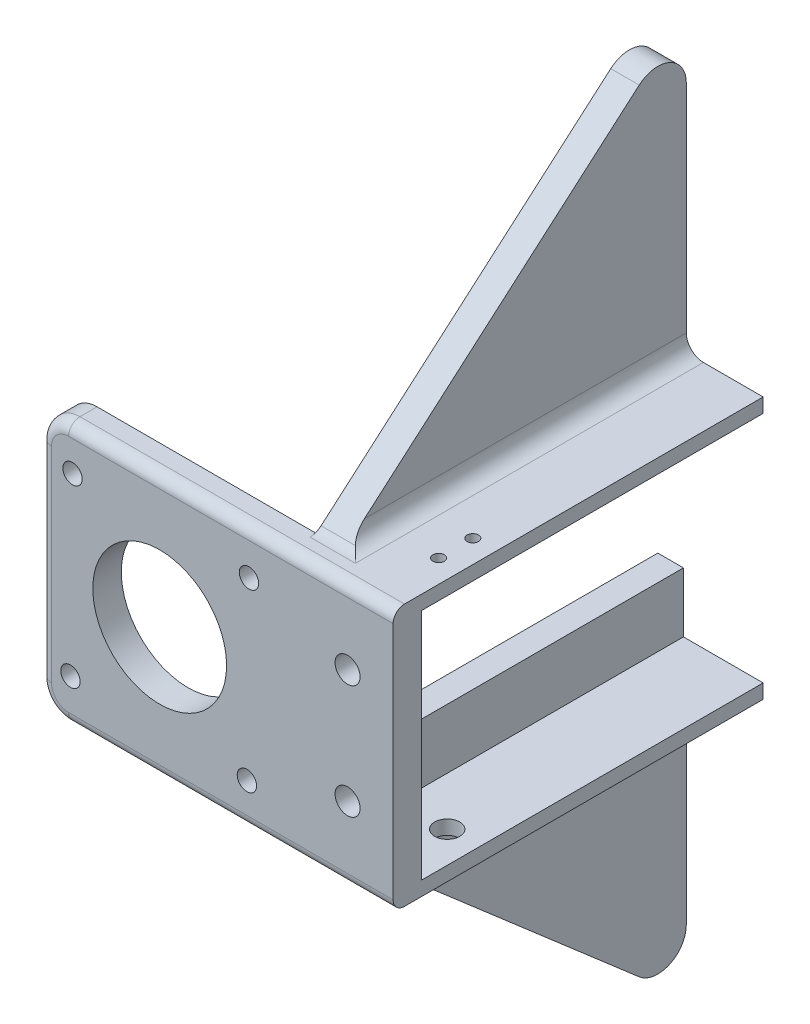
from build123d import *

# Parameters (mm, degrees)
SKETCH_1_W          = 14
SKETCH_1_H          = 2.5
SKETCH_1_R          = 1.7
SKETCH_1_R_2        = 11.75
SKETCH_1_R_3        = 2.2
SKETCH_1_W_2        = 4.5
SKETCH_1_H_2        = 20
EXTRUDE_1_DEPTH     = 5
EXTRUDE_2_DEPTH     = 60
CUT_EXTRUDE_1_REACH = 78.223
CUT_EXTRUDE_2_REACH = 78.223
SKETCH_2_3_R        = 1
EXTRUDE_3_DEPTH     = 5
FILLET_1_R          = 5
FILLET_START        = 22.5
FILLET_2_DEPTH      = 5
FILLET_START_2      = -60
FILLET_2_2_DEPTH    = 61.119099979
FILLET_START_3      = 27.5
FILLET_2_3_DEPTH    = 3
FILLET_3_R          = 2


with BuildPart() as part:
    # 草图1 → 凸台-拉伸1 (new body)
    # profile 1 of 9: a face of its own
    with BuildSketch(Plane.XY):
        with Locations((34, 21.75)):
            Rectangle(SKETCH_1_W, SKETCH_1_H)
    # profile 2 of 9: a face of its own
    with BuildSketch(Plane.XY):
        Polygon((27, 23), (22.5, 23), (22.5, 21.5), (22.5, 10), (27, 10), (27, 20.5), align=None)
    # profile 3 of 9: a face of its own
    with BuildSketch(Plane.XY):
        Polygon((-21, 23), (-21, 21.5), (21, 21.5), (22.5, 21.5), (22.5, 23), align=None)
    # profile 4 of 9: a face of its own
    with BuildSketch(Plane.XY):
        Polygon((21, 21.5), (-21, 21.5), (-21, -21.5), (21, -21.5), (22.5, -21.5), (22.5, -10), (22.5, 10), (22.5, 21.5), align=None)
        with Locations((-15.68126777, -15.316587124)):
            Circle(SKETCH_1_R, mode=Mode.SUBTRACT)
        with Locations((15.316587124, -15.68126777)):
            Circle(SKETCH_1_R, mode=Mode.SUBTRACT)
        Circle(SKETCH_1_R_2, mode=Mode.SUBTRACT)
        with Locations((-15.316587124, 15.68126777)):
            Circle(SKETCH_1_R, mode=Mode.SUBTRACT)
        with Locations((15.68126777, 15.316587124)):
            Circle(SKETCH_1_R, mode=Mode.SUBTRACT)
    # profile 5 of 9: a face of its own
    with BuildSketch(Plane.XY):
        Polygon((41, 20.5), (27, 20.5), (27, 10), (27, -10), (27, -20.5), (41, -20.5), align=None)
        with Locations((33, -10)):
            Circle(SKETCH_1_R_3, mode=Mode.SUBTRACT)
        with Locations((33, 10)):
            Circle(SKETCH_1_R_3, mode=Mode.SUBTRACT)
    # profile 6 of 9: a face of its own
    with BuildSketch(Plane.XY):
        with Locations((24.75, 0)):
            Rectangle(SKETCH_1_W_2, SKETCH_1_H_2)
    # profile 7 of 9: a face of its own
    with BuildSketch(Plane.XY):
        Polygon((22.5, -10), (22.5, -21.5), (22.5, -23), (27, -23), (27, -20.5), (27, -10), align=None)
    # profile 8 of 9: a face of its own
    with BuildSketch(Plane.XY):
        with Locations((34, -21.75)):
            Rectangle(SKETCH_1_W, SKETCH_1_H)
    # profile 9 of 9: a face of its own
    with BuildSketch(Plane.XY):
        Polygon((21, -21.5), (-21, -21.5), (-21, -23), (22.5, -23), (22.5, -21.5), align=None)
    extrude(amount=EXTRUDE_1_DEPTH)

    # 草图1<4> → 凸台-拉伸2 (add)
    with BuildSketch(Plane.XY):
        Polygon((22.5, 23), (22.5, 10), (27, 10), (27, 20.5), (41, 20.5), (41, 23), align=None)
        Polygon((22.5, -10), (22.5, -23), (41, -23), (41, -20.5), (27, -20.5), (27, -10), align=None)
    extrude(amount=-EXTRUDE_2_DEPTH)

    # 草图2 → 切除-拉伸1 (cut, up to next)
    with BuildSketch(Plane(origin=(0, 0, 0), x_dir=(1, 0, 0), z_dir=(0, 1, 0)), mode=Mode.PRIVATE) as cut_extrude_1_sk1:
        with BuildLine():
            ThreePointArc((37.7, 10), (35.5, 12.2), (33.3, 10))
            Line((33.3, 10), (37.7, 10))
        make_face()
    cut_extrude_1_tool1 = extrude(cut_extrude_1_sk1.sketch, amount=-CUT_EXTRUDE_1_REACH, mode=Mode.PRIVATE) & part.part
    # 草图2 → 切除-拉伸1 (cut, up to next)
    with BuildSketch(Plane(origin=(0, 0, 0), x_dir=(1, 0, 0), z_dir=(0, 1, 0)), mode=Mode.PRIVATE) as cut_extrude_1_sk2:
        with BuildLine():
            Line((37.7, 10), (33.3, 10))
            ThreePointArc((33.3, 10), (35.5, 7.8), (37.7, 10))
        make_face()
    cut_extrude_1_tool2 = extrude(cut_extrude_1_sk2.sketch, amount=-CUT_EXTRUDE_1_REACH, mode=Mode.PRIVATE) & part.part
    # 草图2 → 切除-拉伸1 (cut, up to next)
    with BuildSketch(Plane(origin=(0, 0, 0), x_dir=(1, 0, 0), z_dir=(0, 1, 0)), mode=Mode.PRIVATE) as cut_extrude_1_sk3:
        with BuildLine():
            ThreePointArc((37.7, 10), (35.5, 12.2), (33.3, 10))
            Line((33.3, 10), (37.7, 10))
        make_face()
    cut_extrude_1_tool3 = extrude(cut_extrude_1_sk3.sketch, amount=-CUT_EXTRUDE_1_REACH, mode=Mode.PRIVATE) & part.part
    # 草图2 → 切除-拉伸1 (cut, up to next)
    with BuildSketch(Plane(origin=(0, 0, 0), x_dir=(1, 0, 0), z_dir=(0, 1, 0)), mode=Mode.PRIVATE) as cut_extrude_1_sk4:
        with BuildLine():
            Line((37.7, 10), (33.3, 10))
            ThreePointArc((33.3, 10), (35.5, 7.8), (37.7, 10))
        make_face()
    cut_extrude_1_tool4 = extrude(cut_extrude_1_sk4.sketch, amount=-CUT_EXTRUDE_1_REACH, mode=Mode.PRIVATE) & part.part
    add(cut_extrude_1_tool1.solids().sort_by_distance((35.5, 0, -10.933709))[0], mode=Mode.SUBTRACT)
    add(cut_extrude_1_tool2.solids().sort_by_distance((35.5, 0, -9.066291))[0], mode=Mode.SUBTRACT)
    add(cut_extrude_1_tool3.solids().sort_by_distance((35.5, 0, -10.933709))[0], mode=Mode.SUBTRACT)
    add(cut_extrude_1_tool4.solids().sort_by_distance((35.5, 0, -9.066291))[0], mode=Mode.SUBTRACT)

    # 草图2<3> → 切除-拉伸2 (cut, up to next)
    with BuildSketch(Plane(origin=(0, 0, 0), x_dir=(1, 0, 0), z_dir=(0, 1, 0)), mode=Mode.PRIVATE) as cut_extrude_2_sk1:
        with Locations(Location((37, 7, 0), (0, 0, 90))):
            Circle(SKETCH_2_3_R)
    cut_extrude_2_tool1 = extrude(cut_extrude_2_sk1.sketch, amount=CUT_EXTRUDE_2_REACH, mode=Mode.PRIVATE) & part.part
    # 草图2<3> → 切除-拉伸2 (cut, up to next)
    with BuildSketch(Plane(origin=(0, 0, 0), x_dir=(1, 0, 0), z_dir=(0, 1, 0)), mode=Mode.PRIVATE) as cut_extrude_2_sk2:
        with Locations(Location((37, 13, 0), (0, 0, 90))):
            Circle(SKETCH_2_3_R)
    cut_extrude_2_tool2 = extrude(cut_extrude_2_sk2.sketch, amount=CUT_EXTRUDE_2_REACH, mode=Mode.PRIVATE) & part.part
    add(cut_extrude_2_tool1.solids().sort_by_distance((37, 0, -7))[0], mode=Mode.SUBTRACT)
    add(cut_extrude_2_tool2.solids().sort_by_distance((37, 0, -13))[0], mode=Mode.SUBTRACT)

    # 草图5 → 凸台-拉伸3 (add)
    with BuildSketch(Plane.ZY.offset(-22.5)):
        Polygon((-60, 75), (-60, 23), (0, 23), align=None)
        Polygon((0, -23), (-60, -23), (-60, -75), align=None)
    extrude(amount=-EXTRUDE_3_DEPTH)

    # 圆角1
    fillet_1_edges = [part.edges().sort_by_distance(p)[0] for p in [
        (25, -75, -60),
        (25, 75, -60),
        (-21, -23, 2.5),
        (-21, 23, 2.5),
    ]]
    fillet(fillet_1_edges, radius=FILLET_1_R)

    # 圆角2: read off the stored shape, not the designer's step
    # 圆角2 outline → 圆角2 (add)
    with BuildSketch(Plane.YZ.offset(FILLET_START)):
        with BuildLine():
            ThreePointArc((-23, 1.119099979), (-23.189199247, 0.070577625), (-23.732932752, -0.845691636))
            Line((-23.732932752, -0.845691636), (-23, 0))
            Line((-23, 0), (-23, 1.119099979))
        make_face()
        with BuildLine():
            Line((23, 0), (23.732932752, -0.845691636))
            ThreePointArc((23.732932752, -0.845691636), (23.189199247, 0.070577625), (23, 1.119099979))
            Line((23, 1.119099979), (23, 0))
        make_face()
    extrude(amount=FILLET_2_DEPTH)

    # Fillet 2 2 outline → Fillet 2 2 (add)
    with BuildSketch(Plane.XY.offset(FILLET_START_2)):
        with BuildLine():
            Line((27.5, -23), (27.5, -26))
            ThreePointArc((27.5, -26), (28.378679656, -23.878679656), (30.5, -23))
            Line((30.5, -23), (27.5, -23))
        make_face()
        with BuildLine():
            Line((27.5, 23), (30.5, 23))
            ThreePointArc((30.5, 23), (28.378679656, 23.878679656), (27.5, 26))
            Line((27.5, 26), (27.5, 23))
        make_face()
    extrude(amount=FILLET_2_2_DEPTH)

    # Fillet 2 3 outline → Fillet 2 3 (cut)
    with BuildSketch(Plane.YZ.offset(FILLET_START_3)):
        with BuildLine():
            Line((-27.333333343, -5), (-23.732932752, -0.845691636))
            ThreePointArc((-23.732932752, -0.845691636), (-23.189199247, 0.070577625), (-23, 1.119099979))
            Line((-23, 1.119099979), (-28, 1.119099979))
            Line((-28, 1.119099979), (-28, -5))
            Line((-28, -5), (-27.333333343, -5))
        make_face()
        with BuildLine():
            Line((23.732932752, -0.845691636), (27.333333343, -5))
            Line((27.333333343, -5), (28, -5))
            Line((28, -5), (28, 1.119099979))
            Line((28, 1.119099979), (23, 1.119099979))
            ThreePointArc((23, 1.119099979), (23.189199247, 0.070577625), (23.732932752, -0.845691636))
        make_face()
    extrude(amount=FILLET_2_3_DEPTH, mode=Mode.SUBTRACT)

    # 圆角3
    fillet_3_edges = [part.edges().sort_by_distance(p)[0] for p in [
        (-21, 0, 5),
        (12.5, 23, 5),
        (-19.535533906, 21.535533906, 5),
        (-19.535533906, -21.535533906, 5),
        (12.5, -23, 5),
    ]]
    fillet(fillet_3_edges, radius=FILLET_3_R)


solid = part.part
